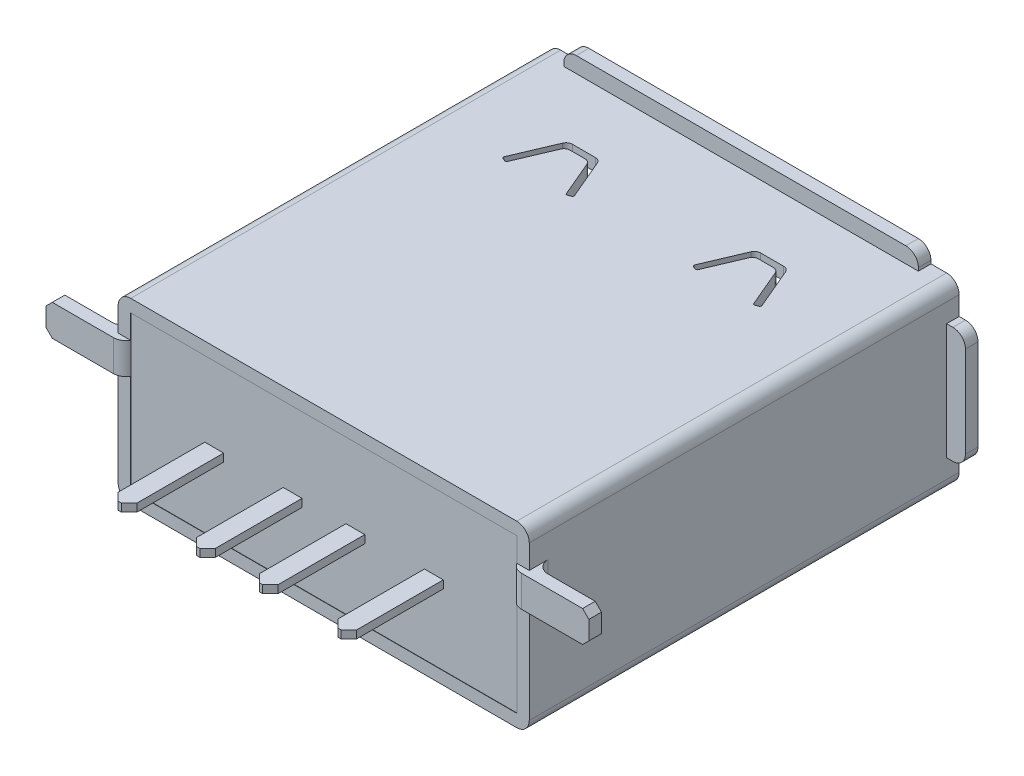
from build123d import *

# Parameters (mm, degrees)
SKETCH1_W           = 13.1
SKETCH1_H           = 5.7
BOSS_EXTRUDE1_DEPTH = 13.7
SKETCH2_W           = 14.3
SKETCH2_H           = 6.7
BOSS_EXTRUDE2_DEPTH = 0.4
SKETCH3_W           = 12.3
SKETCH3_H           = 4.9
CUT_EXTRUDE1_DEPTH  = 13.3
CUT_EXTRUDE4_DEPTH  = 20
SKETCH4_W           = 11
SKETCH4_H           = 1.25
BOSS_EXTRUDE3_DEPTH = 10
SKETCH6_W           = 12.3
SKETCH6_H           = 4.9
CUT_EXTRUDE2_DEPTH  = 0.01
SKETCH5_W           = 0.6
SKETCH5_H           = 12.4
BOSS_EXTRUDE4_DEPTH = 0.25
CHAMFER1_SIZE       = 0.25
CHAMFER2_SIZE       = 1
SKETCH7_W           = 1.303722504
SKETCH7_H           = 1
SKETCH7_W_2         = 0.6
SKETCH7_H_2         = 0.5
SKETCH7_W_3         = 0.9
SKETCH7_H_3         = 1.024932436
SKETCH7_H_4         = 0.734727852
SKETCH7_W_4         = 1.072430983
SKETCH7_H_5         = 0.541984918
SKETCH7_W_5         = 2.701795962
SKETCH7_W_6         = 1.087815585
SKETCH7_H_6         = 1.142332713
CUT_EXTRUDE3_DEPTH  = 0.4
FILLET2_R           = 0.4
SKETCH8_W           = 2.5
SKETCH8_H           = 0.994251334
BOSS_EXTRUDE5_DEPTH = 0.2
CHAMFER3_SIZE       = 0.2
FILLET3_START       = -2.45
FILLET3_DEPTH       = 4.9
FILLET3_START_2     = 0.695504506
FILLET3_2_DEPTH     = 0.994251334


with BuildPart() as part:
    # Sketch1 → Boss-Extrude1 (new body)
    with BuildSketch(Plane.XY):
        Rectangle(SKETCH1_W, SKETCH1_H)
    extrude(amount=BOSS_EXTRUDE1_DEPTH)

    # Sketch2 → Boss-Extrude2 (add)
    with BuildSketch(Plane(origin=(0, 0, 0), x_dir=(-1, 0, 0), z_dir=(0, 0, -1))):
        Rectangle(SKETCH2_W, SKETCH2_H)
    extrude(amount=-BOSS_EXTRUDE2_DEPTH)

    # Sketch3 → Cut-Extrude1 (cut)
    with BuildSketch(Plane(origin=(0, 0, 0), x_dir=(-1, 0, 0), z_dir=(0, 0, -1))):
        Rectangle(SKETCH3_W, SKETCH3_H)
    extrude(amount=-CUT_EXTRUDE1_DEPTH, mode=Mode.SUBTRACT)

    # Sketch9 → Cut-Extrude4 (cut)
    with BuildSketch(Plane(origin=(0, 2.85, 0), x_dir=(1, 0, 0), z_dir=(0, 1, 0))):
        with BuildLine():
            Line((2.632377112, -2.41087328), (3.367622888, -2.41087328))
            ThreePointArc((3.367622888, -2.41087328), (3.478010285, -2.444096115), (3.551723858, -2.532727054))
            Line((3.551723858, -2.532727054), (4.10708657, -3.841079612))
            ThreePointArc((4.10708657, -3.841079612), (4.10742052, -3.879346498), (4.080597884, -3.906641411))
            Line((4.080597884, -3.906641411), (3.988547398, -3.945714524))
            ThreePointArc((3.988547398, -3.945714524), (3.950280512, -3.946048474), (3.922985599, -3.919225838))
            Line((3.922985599, -3.919225838), (3.419346746, -2.732727054))
            ThreePointArc((3.419346746, -2.732727054), (3.345633173, -2.644096115), (3.235245776, -2.61087328))
            Line((3.235245776, -2.61087328), (3, -2.61087328))
            Line((3, -2.61087328), (2.764754224, -2.61087328))
            ThreePointArc((2.764754224, -2.61087328), (2.654366827, -2.644096115), (2.580653254, -2.732727054))
            Line((2.580653254, -2.732727054), (2.097538338, -3.870874472))
            ThreePointArc((2.097538338, -3.870874472), (2.070243425, -3.897697108), (2.031976539, -3.897363158))
            Line((2.031976539, -3.897363158), (1.939926053, -3.858290045))
            ThreePointArc((1.939926053, -3.858290045), (1.913103417, -3.830995132), (1.913437367, -3.792728246))
            Line((1.913437367, -3.792728246), (2.448276142, -2.532727054))
            ThreePointArc((2.448276142, -2.532727054), (2.521989715, -2.444096115), (2.632377112, -2.41087328))
        make_face()
        with BuildLine():
            Line((-3.235245776, -2.61087328), (-3, -2.61087328))
            Line((-3, -2.61087328), (-2.764754224, -2.61087328))
            ThreePointArc((-2.764754224, -2.61087328), (-2.654366827, -2.644096115), (-2.580653254, -2.732727054))
            Line((-2.580653254, -2.732727054), (-2.097538338, -3.870874472))
            ThreePointArc((-2.097538338, -3.870874472), (-2.070243425, -3.897697108), (-2.031976539, -3.897363158))
            Line((-2.031976539, -3.897363158), (-1.939926053, -3.858290045))
            ThreePointArc((-1.939926053, -3.858290045), (-1.913103417, -3.830995132), (-1.913437367, -3.792728246))
            Line((-1.913437367, -3.792728246), (-2.448276142, -2.532727054))
            ThreePointArc((-2.448276142, -2.532727054), (-2.521989715, -2.444096115), (-2.632377112, -2.41087328))
            Line((-2.632377112, -2.41087328), (-3.367622888, -2.41087328))
            ThreePointArc((-3.367622888, -2.41087328), (-3.478010285, -2.444096115), (-3.551723858, -2.532727054))
            Line((-3.551723858, -2.532727054), (-4.10708657, -3.841079612))
            ThreePointArc((-4.10708657, -3.841079612), (-4.10742052, -3.879346498), (-4.080597884, -3.906641411))
            Line((-4.080597884, -3.906641411), (-3.988547398, -3.945714524))
            ThreePointArc((-3.988547398, -3.945714524), (-3.950280512, -3.946048474), (-3.922985599, -3.919225838))
            Line((-3.922985599, -3.919225838), (-3.419346746, -2.732727054))
            ThreePointArc((-3.419346746, -2.732727054), (-3.345633173, -2.644096115), (-3.235245776, -2.61087328))
        make_face()
    extrude(amount=-CUT_EXTRUDE4_DEPTH, mode=Mode.SUBTRACT)

    # Sketch4 → Boss-Extrude3 (add)
    with BuildSketch(Plane(origin=(0, 0, 13.3), x_dir=(-1, 0, 0), z_dir=(0, 0, -1))):
        with Locations((0, -0.825)):
            Rectangle(SKETCH4_W, SKETCH4_H)
    extrude(amount=BOSS_EXTRUDE3_DEPTH)

    # Sketch6 → Cut-Extrude2 (cut)
    with BuildSketch(Plane.XY.offset(13.7)):
        Rectangle(SKETCH6_W, SKETCH6_H)
    extrude(amount=-CUT_EXTRUDE2_DEPTH, mode=Mode.SUBTRACT)

    # Sketch5 → Boss-Extrude4 (add)
    with BuildSketch(Plane(origin=(0, -0.2, 0), x_dir=(1, 0, 0), z_dir=(0, 1, 0))):
        with Locations((3.5, -10.5)):
            Rectangle(SKETCH5_W, SKETCH5_H)
        with Locations((1, -10.5)):
            Rectangle(SKETCH5_W, SKETCH5_H)
        with Locations((-1, -10.5)):
            Rectangle(SKETCH5_W, SKETCH5_H)
        with Locations((-3.5, -10.5)):
            Rectangle(SKETCH5_W, SKETCH5_H)
    extrude(amount=BOSS_EXTRUDE4_DEPTH)

    # Chamfer1
    chamfer1_edges = [part.edges().sort_by_distance(p)[0] for p in [
        (3.8, -0.075, 16.7),
        (3.2, -0.075, 16.7),
        (0.7, -0.075, 16.7),
        (1.3, -0.075, 16.7),
        (-0.7, -0.075, 16.7),
        (-1.3, -0.075, 16.7),
        (-3.2, -0.075, 16.7),
        (-3.8, -0.075, 16.7),
    ]]
    chamfer(chamfer1_edges, length=CHAMFER1_SIZE)

    # Chamfer2
    chamfer2_edges = [part.edges().sort_by_distance(p)[0] for p in [
        (-5.5, -0.825, 3.3),
        (5.5, -0.825, 3.3),
    ]]
    chamfer(chamfer2_edges, length=CHAMFER2_SIZE)

    # Sketch7 → Cut-Extrude3 (cut)
    with BuildSketch(Plane(origin=(0, 0, 0), x_dir=(-1, 0, 0), z_dir=(0, 0, -1))):
        Polygon((-7.15, 3.35), (-6.55, 3.35), (-6.55, 4.374932436), (-8.453722504, 4.374932436), (-8.453722504, 2.85), (-7.15, 2.85), align=None)
        with Locations((-7.801861252, 2.35)):
            Rectangle(SKETCH7_W, SKETCH7_H)
        with Locations((-6.85, 2.35)):
            Rectangle(SKETCH7_W_2, SKETCH7_H)
        with Locations((-6.85, 3.1)):
            Rectangle(SKETCH7_W_2, SKETCH7_H_2)
        with Locations((-6.1, 3.1)):
            Rectangle(SKETCH7_W_3, SKETCH7_H_2)
        with Locations((-6.1, 3.862466218)):
            Rectangle(SKETCH7_W_3, SKETCH7_H_3)
        Polygon((-7.15, -3.35), (-7.15, -2.85), (-8.222430983, -2.85), (-8.222430983, -4.084727852), (-6.55, -4.084727852), (-6.55, -3.35), align=None)
        with Locations((-6.85, -3.1)):
            Rectangle(SKETCH7_W_2, SKETCH7_H_2)
        with Locations((-6.1, -3.717363926)):
            Rectangle(SKETCH7_W_3, SKETCH7_H_4)
        with Locations((-6.1, -3.1)):
            Rectangle(SKETCH7_W_3, SKETCH7_H_2)
        with Locations((-6.85, -2.35)):
            Rectangle(SKETCH7_W_2, SKETCH7_H)
        with Locations((-7.686215492, -2.35)):
            Rectangle(SKETCH7_W_4, SKETCH7_H)
        with Locations((6.1, -3.620992459)):
            Rectangle(SKETCH7_W_3, SKETCH7_H_5)
        Polygon((9.851795962, -2.85), (7.15, -2.85), (7.15, -3.35), (6.55, -3.35), (6.55, -3.891984918), (9.851795962, -3.891984918), align=None)
        with Locations((8.500897981, -2.35)):
            Rectangle(SKETCH7_W_5, SKETCH7_H)
        with Locations((6.85, -3.1)):
            Rectangle(SKETCH7_W_2, SKETCH7_H_2)
        with Locations((6.1, -3.1)):
            Rectangle(SKETCH7_W_3, SKETCH7_H_2)
        with Locations((6.85, -2.35)):
            Rectangle(SKETCH7_W_2, SKETCH7_H)
        with Locations((6.85, 2.35)):
            Rectangle(SKETCH7_W_2, SKETCH7_H)
        with Locations((7.693907793, 2.35)):
            Rectangle(SKETCH7_W_6, SKETCH7_H)
        Polygon((7.15, 3.35), (7.15, 2.85), (8.237815585, 2.85), (8.237815585, 4.492332713), (6.55, 4.492332713), (6.55, 3.35), align=None)
        with Locations((6.1, 3.921166357)):
            Rectangle(SKETCH7_W_3, SKETCH7_H_6)
        with Locations((6.1, 3.1)):
            Rectangle(SKETCH7_W_3, SKETCH7_H_2)
        with Locations((6.85, 3.1)):
            Rectangle(SKETCH7_W_2, SKETCH7_H_2)
    extrude(amount=-CUT_EXTRUDE3_DEPTH, mode=Mode.SUBTRACT)

    # Fillet2
    fillet2_edges = [part.edges().sort_by_distance(p)[0] for p in [
        (6.15, 2.45, 6.65),
        (6.15, -2.45, 6.65),
        (-6.15, -2.45, 6.65),
        (-6.15, 2.45, 6.65),
        (7.15, -1.85, 0.2),
        (5.65, -3.35, 0.2),
        (-5.65, -3.35, 0.2),
        (-7.15, -1.85, 0.2),
        (-7.15, 1.85, 0.2),
        (-5.65, 3.35, 0.2),
        (5.65, 3.35, 0.2),
        (7.15, 1.85, 0.2),
        (6.55, -2.85, 6.85),
        (-6.55, -2.85, 6.85),
        (-6.55, 2.85, 6.85),
        (6.55, 2.85, 6.85),
    ]]
    fillet(fillet2_edges, radius=FILLET2_R)

    # Sketch8 → Boss-Extrude5 (add, symmetric)
    with BuildSketch(Plane.XY.offset(13.7)):
        with Locations((7.4, 1.192630173)):
            Rectangle(SKETCH8_W, SKETCH8_H)
        with Locations((-7.4, 1.192630173)):
            Rectangle(SKETCH8_W, SKETCH8_H)
    extrude(amount=BOSS_EXTRUDE5_DEPTH, both=True)

    # Chamfer3
    chamfer3_edges = [part.edges().sort_by_distance(p)[0] for p in [
        (8.65, 1.68975584, 13.7),
        (8.65, 0.695504506, 13.7),
        (-8.65, 1.68975584, 13.7),
        (-8.65, 0.695504506, 13.7),
    ]]
    chamfer(chamfer3_edges, length=CHAMFER3_SIZE)

    # Fillet3: read off the stored shape, not the designer's step
    # Fillet3 outline → Fillet3 (cut)
    with BuildSketch(Plane(origin=(0, 0, 0), x_dir=(1, 0, 0), z_dir=(0, 1, 0)).offset(FILLET3_START)):
        with BuildLine():
            Line((-6.15, -13.9), (-6.15, -13.69))
            ThreePointArc((-6.15, -13.69), (-6.297055303, -13.843511281), (-6.501994318, -13.9))
            Line((-6.501994318, -13.9), (-6.15, -13.9))
        make_face()
        with BuildLine():
            ThreePointArc((6.501994318, -13.9), (6.297055303, -13.843511281), (6.15, -13.69))
            Line((6.15, -13.69), (6.15, -13.9))
            Line((6.15, -13.9), (6.501994318, -13.9))
        make_face()
    extrude(amount=FILLET3_DEPTH, mode=Mode.SUBTRACT)

    # Fillet3 2 outline → Fillet3 2 (add)
    with BuildSketch(Plane(origin=(0, 0, 0), x_dir=(1, 0, 0), z_dir=(0, 1, 0)).offset(FILLET3_START_2)):
        with BuildLine():
            Line((6.55, -13.5), (6.95, -13.5))
            ThreePointArc((6.95, -13.5), (6.667157288, -13.382842712), (6.55, -13.1))
            Line((6.55, -13.1), (6.55, -13.5))
        make_face()
        with BuildLine():
            Line((-6.95, -13.5), (-6.55, -13.5))
            Line((-6.55, -13.5), (-6.55, -13.1))
            ThreePointArc((-6.55, -13.1), (-6.667157288, -13.382842712), (-6.95, -13.5))
        make_face()
    extrude(amount=FILLET3_2_DEPTH)


solid = part.part
